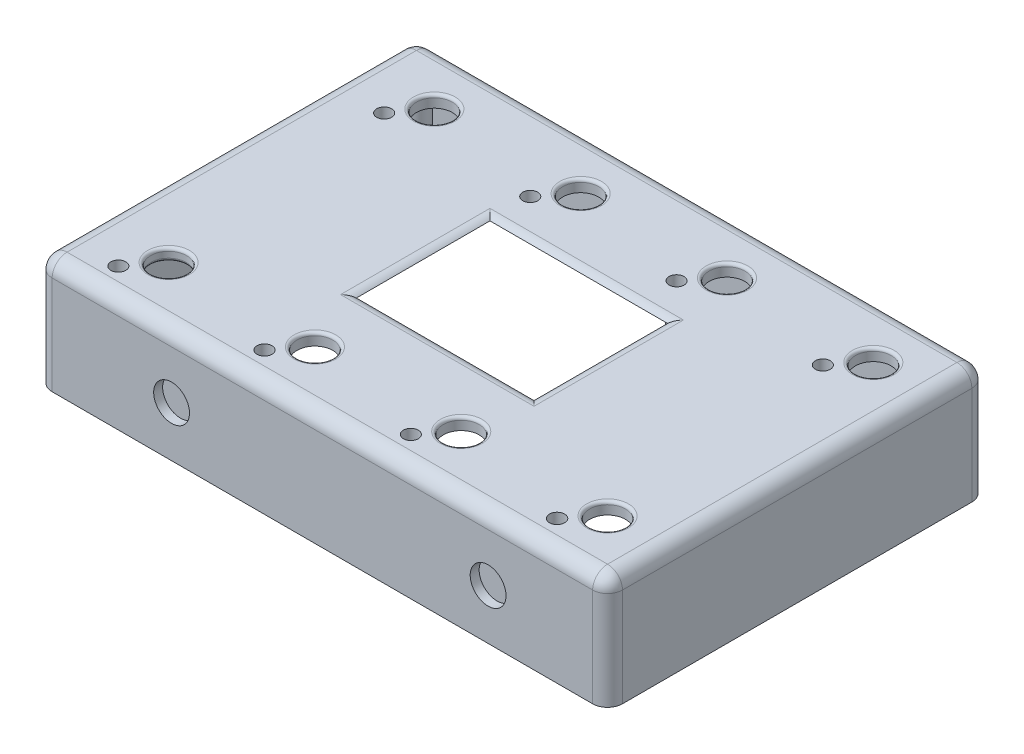
from build123d import *

# Parameters (mm, degrees)
SKETCH11_W                      = 183
SKETCH11_H                      = 119
BOSS_EXTRUDE2_DEPTH             = 34
SHELL19_T                       = 4
BOSS_EXTRUDE4_START             = -34
BOSS_EXTRUDE4_DEPTH             = 34
F_6_32_TAPPED_HOLE1_D           = 2.7051
F_6_32_TAPPED_HOLE1_DEPTH       = 10.97
F_6_32_TAPPED_HOLE1_CSINK_D     = 4.7752
F_6_32_TAPPED_HOLE1_CSINK_ANGLE = 100
F_6_32_TAPPED_HOLE1_TIP         = 0.81269403
FILLET1_R                       = 5
SKETCH15_R                      = 6
CUT_EXTRUDE2_DEPTH              = 153
FILLET2_R                       = 1
SKETCH16_R                      = 6
SKETCH16_W                      = 59.5
SKETCH16_H                      = 44.75
CUT_EXTRUDE3_DEPTH              = 153
FILLET3_R                       = 1
FILLET4_R                       = 1
FILLET5_R                       = 1
FILLET6_R                       = 1
FILLET7_R                       = 1
FILLET8_R                       = 1
FILLET9_R                       = 1
FILLET10_R                      = 1
SKETCH19_R                      = 4
SKETCH19_W                      = 14
SKETCH19_H                      = 8.25
CUT_EXTRUDE4_DEPTH              = 153
SKETCH17_R                      = 6
CUT_EXTRUDE5_DEPTH              = 3
SKETCH22_W                      = 69.6
SKETCH22_H                      = 50.2
CUT_EXTRUDE6_DEPTH              = 3
SKETCH23_R                      = 2.5
SKETCH23_R_2                    = 2.53684151
CUT_EXTRUDE7_DEPTH              = 12
FILLET17_R                      = 4


# Read off the part's stored shape, not the designer's step: Boss-Extrude4
with BuildPart() as part:
    # Sketch11 → Boss-Extrude2 (new body)
    with BuildSketch(Plane(origin=(0, 0, 0), x_dir=(1, 0, 0), z_dir=(0, 1, 0))):
        Rectangle(SKETCH11_W, SKETCH11_H)
    extrude(amount=BOSS_EXTRUDE2_DEPTH)

    # Shell19
    shell19_openings = [part.faces().sort_by_distance(p)[0] for p in [
        (0, 0, 0),
    ]]
    offset(amount=SHELL19_T, openings=shell19_openings, kind=Kind.INTERSECTION)

    # Boss-Extrude4 outline → Boss-Extrude4 (add)
    with BuildSketch(Plane(origin=(0, 0, 0), x_dir=(-1, 0, 0), z_dir=(0, -1, 0)).offset(BOSS_EXTRUDE4_START)):
        with BuildLine():
            Line((-91.5, 59.5), (-91.5, 53.791632513))
            ThreePointArc((-91.5, 53.791632513), (-86.395109023, 54.372298689), (-86.072984276, 59.5))
            Line((-86.072984276, 59.5), (-91.5, 59.5))
        make_face()
        with BuildLine():
            ThreePointArc((-86.295538716, -59.5), (-86.27586418, -54.227632818), (-91.5, -53.51584091))
            Line((-91.5, -53.51584091), (-91.5, -59.5))
            Line((-91.5, -59.5), (-86.295538716, -59.5))
        make_face()
        with BuildLine():
            Line((3.221091031, 59.5), (-3.221091031, 59.5))
            ThreePointArc((-3.221091031, 59.5), (0, 53.128381867), (3.221091031, 59.5))
        make_face()
        with BuildLine():
            ThreePointArc((2.998536591, -59.5), (0, -52.852590264), (-2.998536591, -59.5))
            Line((-2.998536591, -59.5), (2.998536591, -59.5))
        make_face()
        with BuildLine():
            Line((91.5, 59.5), (86.08073914, 59.5))
            ThreePointArc((86.08073914, 59.5), (86.399665621, 54.375666676), (91.5, 53.786518703))
            Line((91.5, 53.786518703), (91.5, 59.5))
        make_face()
        with BuildLine():
            ThreePointArc((91.5, -53.5107271), (86.280573114, -54.231139178), (86.30329358, -59.5))
            Line((86.30329358, -59.5), (91.5, -59.5))
            Line((91.5, -59.5), (91.5, -53.5107271))
        make_face()
    extrude(amount=BOSS_EXTRUDE4_DEPTH)

    # #6-32 Tapped Hole1
    with Locations(Plane(origin=(0, 0, 0), x_dir=(-1, 0, 0), z_dir=(0, -1, 0))):
        with Locations((-89.294075307, 57.128381867), (-89.294075307, -56.852590264), (0, -56.852590264), (0, 57.128381867), (89.301830171, 57.128381867), (89.301830171, -56.852590264)):
            CounterSinkHole(F_6_32_TAPPED_HOLE1_D / 2, F_6_32_TAPPED_HOLE1_CSINK_D / 2, depth=F_6_32_TAPPED_HOLE1_DEPTH, counter_sink_angle=F_6_32_TAPPED_HOLE1_CSINK_ANGLE)
            with Locations((0, 0, -(F_6_32_TAPPED_HOLE1_DEPTH + F_6_32_TAPPED_HOLE1_TIP / 2))):  # 118° drill point
                Cone(0, F_6_32_TAPPED_HOLE1_D / 2, F_6_32_TAPPED_HOLE1_TIP, mode=Mode.SUBTRACT)

    # Fillet1
    fillet1_edges = [part.edges().sort_by_distance(p)[0] for p in [
        (-95.5, 38, 0),
        (0, 38, 63.5),
        (95.5, 38, 0),
        (95.5, 19, 63.5),
        (-95.5, 19, 63.5),
        (-95.5, 19, -63.5),
        (95.5, 19, -63.5),
        (0, 38, -63.5),
    ]]
    fillet(fillet1_edges, radius=FILLET1_R)

    # Sketch15 → Cut-Extrude2 (cut)
    with BuildSketch(Plane(origin=(0, 0, 0), x_dir=(1, 0, 0), z_dir=(0, 1, 0))):
        with Locations(Location((-70.5, 44.5, 0), (0, 0, 270))):
            Circle(SKETCH15_R)
    extrude(amount=CUT_EXTRUDE2_DEPTH, mode=Mode.SUBTRACT)

    # Fillet2
    fillet2_edges = [part.edges().sort_by_distance(p)[0] for p in [
        (-70.5, 38, -50.5),
    ]]
    fillet(fillet2_edges, radius=FILLET2_R)

    # Sketch16 → Cut-Extrude3 (cut)
    with BuildSketch(Plane(origin=(0, 38, 0), x_dir=(1, 0, 0), z_dir=(0, 1, 0))):
        with Locations(Location((76.5, 44.5, 0), (0, 0, 270))):
            Circle(SKETCH16_R)
        with Locations(Location((-21.5, 44.5, 0), (0, 0, 270))):
            Circle(SKETCH16_R)
        with Locations(Location((27.5, 44.5, 0), (0, 0, 270))):
            Circle(SKETCH16_R)
        with Locations(Location((-70.5, -44.5, 0), (0, 0, 270))):
            Circle(SKETCH16_R)
        with Locations(Location((76.5, -44.5, 0), (0, 0, 270))):
            Circle(SKETCH16_R)
        with Locations(Location((27.5, -44.5, 0), (0, 0, 270))):
            Circle(SKETCH16_R)
        with Locations(Location((-21.5, -44.5, 0), (0, 0, 270))):
            Circle(SKETCH16_R)
        Rectangle(SKETCH16_W, SKETCH16_H)
    extrude(amount=-CUT_EXTRUDE3_DEPTH, mode=Mode.SUBTRACT)

    # Fillet3
    fillet3_edges = [part.edges().sort_by_distance(p)[0] for p in [
        (-21.5, 38, -50.5),
    ]]
    fillet(fillet3_edges, radius=FILLET3_R)

    # Fillet4
    fillet4_edges = [part.edges().sort_by_distance(p)[0] for p in [
        (27.5, 38, -50.5),
    ]]
    fillet(fillet4_edges, radius=FILLET4_R)

    # Fillet5
    fillet5_edges = [part.edges().sort_by_distance(p)[0] for p in [
        (76.5, 38, -50.5),
    ]]
    fillet(fillet5_edges, radius=FILLET5_R)

    # Fillet6
    fillet6_edges = [part.edges().sort_by_distance(p)[0] for p in [
        (-70.5, 34, 38.5),
    ]]
    fillet(fillet6_edges, radius=FILLET6_R)

    # Fillet7
    fillet7_edges = [part.edges().sort_by_distance(p)[0] for p in [
        (-70.5, 38, 38.5),
    ]]
    fillet(fillet7_edges, radius=FILLET7_R)

    # Fillet8
    fillet8_edges = [part.edges().sort_by_distance(p)[0] for p in [
        (-21.5, 38, 38.5),
    ]]
    fillet(fillet8_edges, radius=FILLET8_R)

    # Fillet9
    fillet9_edges = [part.edges().sort_by_distance(p)[0] for p in [
        (27.5, 38, 38.5),
    ]]
    fillet(fillet9_edges, radius=FILLET9_R)

    # Fillet10
    fillet10_edges = [part.edges().sort_by_distance(p)[0] for p in [
        (76.5, 38, 38.5),
    ]]
    fillet(fillet10_edges, radius=FILLET10_R)

    # Sketch19 → Cut-Extrude4 (cut)
    with BuildSketch(Plane(origin=(0, 0, 0), x_dir=(0, 0, -1), z_dir=(1, 0, 0))):
        with Locations((-37.235373994, 21.795565076)):
            Circle(SKETCH19_R)
        with Locations((27.844297641, 21.795565076)):
            Circle(SKETCH19_R)
        with Locations((12.267115017, 21.795565076)):
            Rectangle(SKETCH19_W, SKETCH19_H)
    extrude(amount=-CUT_EXTRUDE4_DEPTH, mode=Mode.SUBTRACT)

    # Sketch17 → Cut-Extrude5 (cut)
    with BuildSketch(Plane.XY.offset(63.5)):
        with Locations((-50.5, 16.823905987)):
            Circle(SKETCH17_R)
        with Locations((55.5, 16.823905987)):
            Circle(SKETCH17_R)
    extrude(amount=-CUT_EXTRUDE5_DEPTH, mode=Mode.SUBTRACT)

    # Sketch22 → Cut-Extrude6 (cut)
    with BuildSketch(Plane(origin=(0, 34, 0), x_dir=(-1, 0, 0), z_dir=(0, -1, 0))):
        with Locations((2.45, 0.375)):
            Rectangle(SKETCH22_W, SKETCH22_H)
    extrude(amount=-CUT_EXTRUDE6_DEPTH, mode=Mode.SUBTRACT)

    # Sketch23 → Cut-Extrude7 (cut)
    with BuildSketch(Plane(origin=(0, 34, 0), x_dir=(-1, 0, 0), z_dir=(0, -1, 0))):
        with Locations(Location((77.870840377, -53.969462083, 0), (0, 0, 90))):
            Circle(SKETCH23_R)
        with Locations(Location((29.059828741, -53.81928052, 0), (0, 0, 90))):
            Circle(SKETCH23_R)
        with Locations(Location((-19.933531864, -53.813890699, 0), (0, 0, 90))):
            Circle(SKETCH23_R)
        with Locations(Location((-68.770380914, -53.678942683, 0), (0, 0, 90))):
            Circle(SKETCH23_R_2)
        with Locations(Location((77.753942044, 34.940694334, 0), (0, 0, 90))):
            Circle(SKETCH23_R)
        with Locations(Location((29.087010128, 35.202834985, 0), (0, 0, 90))):
            Circle(SKETCH23_R)
        with Locations(Location((-19.872355714, 35.236143209, 0), (0, 0, 90))):
            Circle(SKETCH23_R)
        with Locations(Location((-68.783003859, 35.310442309, 0), (0, 0, 90))):
            Circle(SKETCH23_R)
    extrude(amount=-CUT_EXTRUDE7_DEPTH, mode=Mode.SUBTRACT)

    # Fillet17
    # the kernel refuses this fillet: 4 mm, written as the material it takes off along each edge
    with BuildSketch(Plane(origin=(29.75, 38, 22.375), x_dir=(0, 0, 1), z_dir=(-1, 0, 0)), Plane(origin=(-29.75, 38, -22.375), x_dir=(0, 0, -1), z_dir=(1, 0, 0))) as fillet17_piece_1:
        with BuildLine():
            CenterArc((2.645751311, -4), FILLET17_R, 90, 41.409622109)
            Line((0, -1), (-0.052915026, -0.94))
            ThreePointArc((-0.052915026, -0.94), (-0.08, -0.5), (-0.08, 0))
            Line((-0.08, 0), (0, 0.08))
            Line((0, 0.08), (2.645751311, 0.08))
            Line((2.645751311, 0.08), (2.645751311, 0))
        make_face()
    extrude(amount=59.5, mode=Mode.SUBTRACT)
    with BuildSketch(Plane(origin=(-29.75, 38, 22.375), x_dir=(-1, 0, 0), z_dir=(0, 0, -1)), Plane(origin=(29.75, 38, -22.375), x_dir=(1, 0, 0), z_dir=(0, 0, 1))) as fillet17_piece_2:
        with BuildLine():
            CenterArc((2.645751311, -4), FILLET17_R, 90, 41.409622109)
            Line((0, -1), (-0.052915026, -0.94))
            ThreePointArc((-0.052915026, -0.94), (-0.08, -0.5), (-0.08, 0))
            Line((-0.08, 0), (0, 0.08))
            Line((0, 0.08), (2.645751311, 0.08))
            Line((2.645751311, 0.08), (2.645751311, 0))
        make_face()
    extrude(amount=44.75, mode=Mode.SUBTRACT)
    with BuildSketch(Plane(origin=(29.75, 38, -22.375), x_dir=(1, 0, 0), z_dir=(0, 0, 1))) as fillet17_piece_3a_section:
        with BuildLine():
            CenterArc((2.645751311, -4), FILLET17_R, 90, 41.409622109)
            Line((0, -1), (-0.052915026, -0.94))
            ThreePointArc((-0.052915026, -0.94), (-0.08, -0.5), (-0.08, 0))
            Line((-0.08, 0), (0, 0.08))
            Line((0, 0.08), (2.645751311, 0.08))
            Line((2.645751311, 0.08), (2.645751311, 0))
        make_face()
    fillet17_piece_3a = extrude(amount=51.364378278, mode=Mode.PRIVATE)
    fillet17_piece_3a = split(fillet17_piece_3a, bisect_by=Plane(origin=(30.475630265, 37.760900038, 22.375), z_dir=(0, 0, 1)), keep=Keep.TOP, mode=Mode.PRIVATE)
    with BuildSketch(Plane(origin=(36.364378278, 38, 22.375), x_dir=(0, 0, 1), z_dir=(-1, 0, 0))) as fillet17_piece_3b_section:
        with BuildLine():
            CenterArc((2.645751311, -4), FILLET17_R, 90, 41.409622109)
            Line((0, -1), (-0.052915026, -0.94))
            ThreePointArc((-0.052915026, -0.94), (-0.08, -0.5), (-0.08, 0))
            Line((-0.08, 0), (0, 0.08))
            Line((0, 0.08), (2.645751311, 0.08))
            Line((2.645751311, 0.08), (2.645751311, 0))
        make_face()
    fillet17_piece_3b = extrude(amount=66.114378278, mode=Mode.PRIVATE)
    fillet17_piece_3b = split(fillet17_piece_3b, bisect_by=Plane(origin=(29.75, 37.760900038, 23.100630265), z_dir=(1, 0, 0)), keep=Keep.TOP, mode=Mode.PRIVATE)
    fillet17_piece_3 = fillet17_piece_3a & fillet17_piece_3b
    add(fillet17_piece_3, mode=Mode.SUBTRACT)
    with BuildSketch(Plane(origin=(-29.75, 38, 28.989378278), x_dir=(-1, 0, 0), z_dir=(0, 0, -1))) as fillet17_piece_4a_section:
        with BuildLine():
            CenterArc((2.645751311, -4), FILLET17_R, 90, 41.409622109)
            Line((0, -1), (-0.052915026, -0.94))
            ThreePointArc((-0.052915026, -0.94), (-0.08, -0.5), (-0.08, 0))
            Line((-0.08, 0), (0, 0.08))
            Line((0, 0.08), (2.645751311, 0.08))
            Line((2.645751311, 0.08), (2.645751311, 0))
        make_face()
    fillet17_piece_4a = extrude(amount=51.364378278, mode=Mode.PRIVATE)
    fillet17_piece_4a = split(fillet17_piece_4a, bisect_by=Plane(origin=(-30.475630265, 37.760900038, 22.375), z_dir=(0, 0, 1)), keep=Keep.TOP, mode=Mode.PRIVATE)
    with BuildSketch(Plane(origin=(29.75, 38, 22.375), x_dir=(0, 0, 1), z_dir=(-1, 0, 0))) as fillet17_piece_4b_section:
        with BuildLine():
            CenterArc((2.645751311, -4), FILLET17_R, 90, 41.409622109)
            Line((0, -1), (-0.052915026, -0.94))
            ThreePointArc((-0.052915026, -0.94), (-0.08, -0.5), (-0.08, 0))
            Line((-0.08, 0), (0, 0.08))
            Line((0, 0.08), (2.645751311, 0.08))
            Line((2.645751311, 0.08), (2.645751311, 0))
        make_face()
    fillet17_piece_4b = extrude(amount=66.114378278, mode=Mode.PRIVATE)
    fillet17_piece_4b = split(fillet17_piece_4b, bisect_by=Plane(origin=(-29.75, 37.760900038, 23.100630265), z_dir=(-1, 0, 0)), keep=Keep.TOP, mode=Mode.PRIVATE)
    fillet17_piece_4 = fillet17_piece_4a & fillet17_piece_4b
    add(fillet17_piece_4, mode=Mode.SUBTRACT)
    with BuildSketch(Plane(origin=(-36.364378278, 38, -22.375), x_dir=(0, 0, -1), z_dir=(1, 0, 0))) as fillet17_piece_5a_section:
        with BuildLine():
            CenterArc((2.645751311, -4), FILLET17_R, 90, 41.409622109)
            Line((0, -1), (-0.052915026, -0.94))
            ThreePointArc((-0.052915026, -0.94), (-0.08, -0.5), (-0.08, 0))
            Line((-0.08, 0), (0, 0.08))
            Line((0, 0.08), (2.645751311, 0.08))
            Line((2.645751311, 0.08), (2.645751311, 0))
        make_face()
    fillet17_piece_5a = extrude(amount=66.114378278, mode=Mode.PRIVATE)
    fillet17_piece_5a = split(fillet17_piece_5a, bisect_by=Plane(origin=(-29.75, 37.760900038, -23.100630265), z_dir=(-1, 0, 0)), keep=Keep.TOP, mode=Mode.PRIVATE)
    with BuildSketch(Plane(origin=(-29.75, 38, 22.375), x_dir=(-1, 0, 0), z_dir=(0, 0, -1))) as fillet17_piece_5b_section:
        with BuildLine():
            CenterArc((2.645751311, -4), FILLET17_R, 90, 41.409622109)
            Line((0, -1), (-0.052915026, -0.94))
            ThreePointArc((-0.052915026, -0.94), (-0.08, -0.5), (-0.08, 0))
            Line((-0.08, 0), (0, 0.08))
            Line((0, 0.08), (2.645751311, 0.08))
            Line((2.645751311, 0.08), (2.645751311, 0))
        make_face()
    fillet17_piece_5b = extrude(amount=51.364378278, mode=Mode.PRIVATE)
    fillet17_piece_5b = split(fillet17_piece_5b, bisect_by=Plane(origin=(-30.475630265, 37.760900038, -22.375), z_dir=(0, 0, -1)), keep=Keep.TOP, mode=Mode.PRIVATE)
    fillet17_piece_5 = fillet17_piece_5a & fillet17_piece_5b
    add(fillet17_piece_5, mode=Mode.SUBTRACT)
    with BuildSketch(Plane(origin=(-29.75, 38, -22.375), x_dir=(0, 0, -1), z_dir=(1, 0, 0))) as fillet17_piece_6a_section:
        with BuildLine():
            CenterArc((2.645751311, -4), FILLET17_R, 90, 41.409622109)
            Line((0, -1), (-0.052915026, -0.94))
            ThreePointArc((-0.052915026, -0.94), (-0.08, -0.5), (-0.08, 0))
            Line((-0.08, 0), (0, 0.08))
            Line((0, 0.08), (2.645751311, 0.08))
            Line((2.645751311, 0.08), (2.645751311, 0))
        make_face()
    fillet17_piece_6a = extrude(amount=66.114378278, mode=Mode.PRIVATE)
    fillet17_piece_6a = split(fillet17_piece_6a, bisect_by=Plane(origin=(29.75, 37.760900038, -23.100630265), z_dir=(1, 0, 0)), keep=Keep.TOP, mode=Mode.PRIVATE)
    with BuildSketch(Plane(origin=(29.75, 38, -28.989378278), x_dir=(1, 0, 0), z_dir=(0, 0, 1))) as fillet17_piece_6b_section:
        with BuildLine():
            CenterArc((2.645751311, -4), FILLET17_R, 90, 41.409622109)
            Line((0, -1), (-0.052915026, -0.94))
            ThreePointArc((-0.052915026, -0.94), (-0.08, -0.5), (-0.08, 0))
            Line((-0.08, 0), (0, 0.08))
            Line((0, 0.08), (2.645751311, 0.08))
            Line((2.645751311, 0.08), (2.645751311, 0))
        make_face()
    fillet17_piece_6b = extrude(amount=51.364378278, mode=Mode.PRIVATE)
    fillet17_piece_6b = split(fillet17_piece_6b, bisect_by=Plane(origin=(30.475630265, 37.760900038, -22.375), z_dir=(0, 0, -1)), keep=Keep.TOP, mode=Mode.PRIVATE)
    fillet17_piece_6 = fillet17_piece_6a & fillet17_piece_6b
    add(fillet17_piece_6, mode=Mode.SUBTRACT)


solid = part.part
